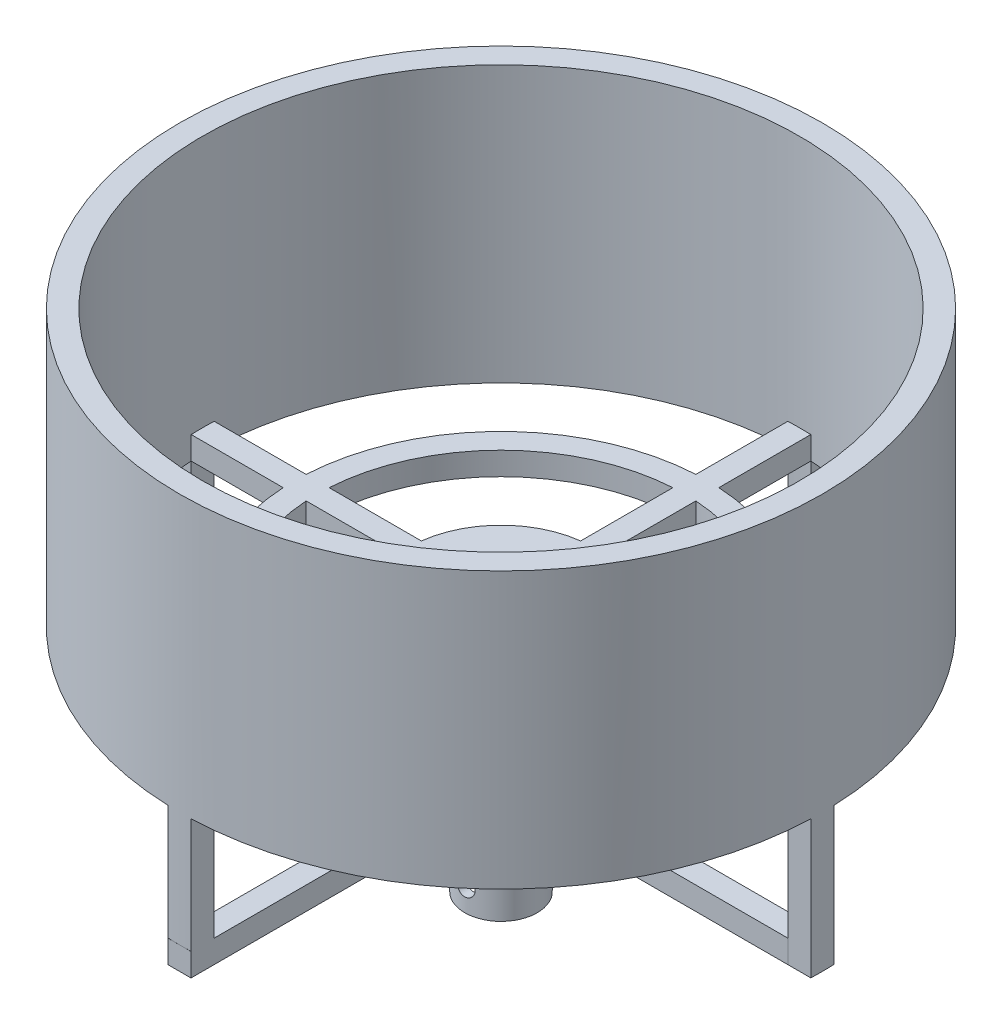
from build123d import *
from build123d.topology import SkipClean

# Parameters (mm, degrees)
SKETCH1_R            = 70
SKETCH1_R_2          = 65
BOSS_EXTRUDE2_DEPTH  = 60
SKETCH3_R            = 65
BOSS_EXTRUDE4_DEPTH  = 5
CUT_EXTRUDE1_START   = -5
CUT_EXTRUDE1_DEPTH   = 5
SKETCH5_R            = 1.5
CUT_EXTRUDE2_DEPTH   = 5
SKETCH6_R            = 45
SKETCH6_R_2          = 40
BOSS_EXTRUDE5_DEPTH  = 5
BOSS_EXTRUDE7_START  = 30
BOSS_EXTRUDE7_DEPTH  = 30
SKETCH21_W           = 5
SKETCH21_H           = 5
BOSS_EXTRUDE10_DEPTH = 137
CIRPATTERN1_COUNT    = 2
CIRPATTERN1_ANGLE    = 90
SKETCH22_R           = 20
BOSS_EXTRUDE13_DEPTH = 5
SKETCH23_R           = 10
BOSS_EXTRUDE14_DEPTH = 10
SKETCH24_R           = 7.9
BOSS_EXTRUDE15_DEPTH = 10
SKETCH25_R           = 6
CUT_EXTRUDE3_DEPTH   = 30
SKETCH28_R           = 2
CUT_EXTRUDE4_DEPTH   = 30
SKETCH29_R           = 20
BOSS_EXTRUDE16_DEPTH = 5
SKETCH30_R           = 1.5
CUT_EXTRUDE5_DEPTH   = 5


with BuildPart() as part:
    # Sketch1 → Boss-Extrude2 (new body)
    with BuildSketch(Plane(origin=(0, 0, 0), x_dir=(1, 0, 0), z_dir=(0, 1, 0))):
        Circle(SKETCH1_R)
        Circle(SKETCH1_R_2, mode=Mode.SUBTRACT)
    extrude(amount=BOSS_EXTRUDE2_DEPTH)

    # Sketch3 → Boss-Extrude4 (add)
    with BuildSketch(Plane(origin=(0, 0, 0), x_dir=(-1, 0, 0), z_dir=(0, -1, 0))):
        Circle(SKETCH3_R)
    extrude(amount=-BOSS_EXTRUDE4_DEPTH)

    # Sketch4 → Cut-Extrude1 (cut)
    with BuildSketch(Plane(origin=(0, 5, 0), x_dir=(1, 0, 0), z_dir=(0, 1, 0)).offset(CUT_EXTRUDE1_START)):
        with BuildLine():
            ThreePointArc((2.5, 19.843134833), (14.142135624, 14.142135624), (19.843134833, 2.5))
            Line((19.843134833, 2.5), (64.951905284, 2.5))
            ThreePointArc((64.951905284, 2.5), (45.961940777, 45.961940777), (2.5, 64.951905284))
            Line((2.5, 64.951905284), (2.5, 19.843134833))
        make_face()
        with BuildLine():
            Line((64.951905284, -2.5), (19.843134833, -2.5))
            ThreePointArc((19.843134833, -2.5), (14.142135624, -14.142135624), (2.5, -19.843134833))
            Line((2.5, -19.843134833), (2.5, -64.951905284))
            ThreePointArc((2.5, -64.951905284), (45.961940777, -45.961940777), (64.951905284, -2.5))
        make_face()
        with BuildLine():
            ThreePointArc((-19.843134833, 2.5), (-14.141970876, 14.14230037), (-2.499537679, 19.843193074))
            Line((-2.499537679, 19.843193074), (-2.499537679, 64.951923077))
            ThreePointArc((-2.499537679, 64.951923077), (-45.961777201, 45.962104353), (-64.951905284, 2.5))
            Line((-64.951905284, 2.5), (-19.843134833, 2.5))
        make_face()
        with BuildLine():
            Line((-2.499537679, -64.951923077), (-2.499537679, -19.843193074))
            ThreePointArc((-2.499537679, -19.843193074), (-14.141970876, -14.14230037), (-19.843134833, -2.5))
            Line((-19.843134833, -2.5), (-64.951905284, -2.5))
            ThreePointArc((-64.951905284, -2.5), (-45.961777201, -45.962104353), (-2.499537679, -64.951923077))
        make_face()
    extrude(amount=CUT_EXTRUDE1_DEPTH, mode=Mode.SUBTRACT)

    # Sketch5 → Cut-Extrude2 (cut)
    with BuildSketch(Plane(origin=(0, 5, 0), x_dir=(1, 0, 0), z_dir=(0, 1, 0))):
        with Locations((9.5, 0)):
            Circle(SKETCH5_R)
        with Locations((-9.5, 0)):
            Circle(SKETCH5_R)
        with Locations((0, 9.5)):
            Circle(SKETCH5_R)
        with Locations((0, -9.5)):
            Circle(SKETCH5_R)
    extrude(amount=-CUT_EXTRUDE2_DEPTH, mode=Mode.SUBTRACT)

    # Sketch6 → Boss-Extrude5 (add)
    with BuildSketch(Plane(origin=(0, 5, 0), x_dir=(1, 0, 0), z_dir=(0, 1, 0))):
        Circle(SKETCH6_R)
        Circle(SKETCH6_R_2, mode=Mode.SUBTRACT)
    extrude(amount=-BOSS_EXTRUDE5_DEPTH)

    # Sketch20 → Boss-Extrude7 (add)
    with SkipClean():  # the faces are left unmerged after this step: merging them gives an invalid solid
        with BuildSketch(Plane(origin=(0, 0, 0), x_dir=(-1, 0, 0), z_dir=(0, -1, 0)).offset(BOSS_EXTRUDE7_START)):
            with BuildLine():
                Line((-64.951905284, -2.5), (-69.955342898, -2.5))
                ThreePointArc((-69.955342898, -2.5), (-70, 0), (-69.955342898, 2.5))
                Line((-69.955342898, 2.5), (-64.951905284, 2.5))
                ThreePointArc((-64.951905284, 2.5), (-65, 0), (-64.951905284, -2.5))
            make_face()
            with BuildLine():
                Line((2.5, 64.951905284), (2.5, 69.955342898))
                ThreePointArc((2.5, 69.955342898), (0, 70), (-2.5, 69.955342898))
                Line((-2.5, 69.955342898), (-2.5, 64.951905284))
                ThreePointArc((-2.5, 64.951905284), (0, 65), (2.5, 64.951905284))
            make_face()
            with BuildLine():
                Line((64.951905284, -2.5), (69.955342898, -2.5))
                ThreePointArc((69.955342898, -2.5), (70, 0), (69.955342898, 2.5))
                Line((69.955342898, 2.5), (64.951905284, 2.5))
                ThreePointArc((64.951905284, 2.5), (65, 0), (64.951905284, -2.5))
            make_face()
            with BuildLine():
                Line((-2.5, -64.951905284), (-2.5, -69.955342898))
                ThreePointArc((-2.5, -69.955342898), (0, -70), (2.5, -69.955342898))
                Line((2.5, -69.955342898), (2.5, -64.951905284))
                ThreePointArc((2.5, -64.951905284), (0, -65), (-2.5, -64.951905284))
            make_face()
        extrude(amount=-BOSS_EXTRUDE7_DEPTH)

    # Sketch21 → Boss-Extrude10 (add)
    with SkipClean():  # the faces are left unmerged after this step: merging them gives an invalid solid
        with BuildSketch(Plane.XY.offset(70)):
            with Locations((0, -27.5)):
                Rectangle(SKETCH21_W, SKETCH21_H)
        boss_extrude10 = extrude(amount=-BOSS_EXTRUDE10_DEPTH)

    # CirPattern1: Boss-Extrude10 ×2 about axis
    with SkipClean():  # the faces are left unmerged after this step: merging them gives an invalid solid
        cirpattern1_axis = Axis((0, 0, 0), (0, -1, 0))
        for i in range(1, CIRPATTERN1_COUNT):
            add(boss_extrude10.rotate(cirpattern1_axis, i * CIRPATTERN1_ANGLE / (CIRPATTERN1_COUNT - 1)))

    # Sketch22 → Boss-Extrude13 (add)
    with SkipClean():  # the faces are left unmerged after this step: merging them gives an invalid solid
        with BuildSketch(Plane(origin=(0, -30, 0), x_dir=(-1, 0, 0), z_dir=(0, -1, 0))):
            Circle(SKETCH22_R)
        extrude(amount=-BOSS_EXTRUDE13_DEPTH)

    # Sketch23 → Boss-Extrude14 (add)
    with SkipClean():  # the faces are left unmerged after this step: merging them gives an invalid solid
        with BuildSketch(Plane(origin=(0, -30, 0), x_dir=(-1, 0, 0), z_dir=(0, -1, 0))):
            Circle(SKETCH23_R)
        extrude(amount=BOSS_EXTRUDE14_DEPTH)

    # Sketch24 → Boss-Extrude15 (add)
    with SkipClean():  # the faces are left unmerged after this step: merging them gives an invalid solid
        with BuildSketch(Plane(origin=(0, -40, 0), x_dir=(-1, 0, 0), z_dir=(0, -1, 0))):
            Circle(SKETCH24_R)
        extrude(amount=BOSS_EXTRUDE15_DEPTH)

    # Sketch25 → Cut-Extrude3 (cut)
    with SkipClean():  # the faces are left unmerged after this step: merging them gives an invalid solid
        with BuildSketch(Plane(origin=(0, -50, 0), x_dir=(-1, 0, 0), z_dir=(0, -1, 0))):
            Circle(SKETCH25_R)
        extrude(amount=-CUT_EXTRUDE3_DEPTH, mode=Mode.SUBTRACT)

    # Sketch28 → Cut-Extrude4 (cut)
    with SkipClean():  # the faces are left unmerged after this step: merging them gives an invalid solid
        with BuildSketch(Plane(origin=(0, -50, 7.9), x_dir=(1, 0, 0), z_dir=(0, 0, 1))):
            with Locations((0, 5)):
                Circle(SKETCH28_R)
        extrude(amount=-CUT_EXTRUDE4_DEPTH, mode=Mode.SUBTRACT)

    # Sketch29 → Boss-Extrude16 (add)
    with SkipClean():  # the faces are left unmerged after this step: merging them gives an invalid solid
        with BuildSketch(Plane(origin=(0, 0, 0), x_dir=(-1, 0, 0), z_dir=(0, -1, 0))):
            Circle(SKETCH29_R)
        extrude(amount=-BOSS_EXTRUDE16_DEPTH)

    # Sketch30 → Cut-Extrude5 (cut)
    with SkipClean():  # the faces are left unmerged after this step: merging them gives an invalid solid
        with BuildSketch(Plane(origin=(0, 0, 0), x_dir=(-1, 0, 0), z_dir=(0, -1, 0))):
            with Locations((-17, 0)):
                Circle(SKETCH30_R)
            with Locations((0, 17)):
                Circle(SKETCH30_R)
            with Locations((17, 0)):
                Circle(SKETCH30_R)
            with Locations((0, -17)):
                Circle(SKETCH30_R)
        extrude(amount=-CUT_EXTRUDE5_DEPTH, mode=Mode.SUBTRACT)


solid = part.part
